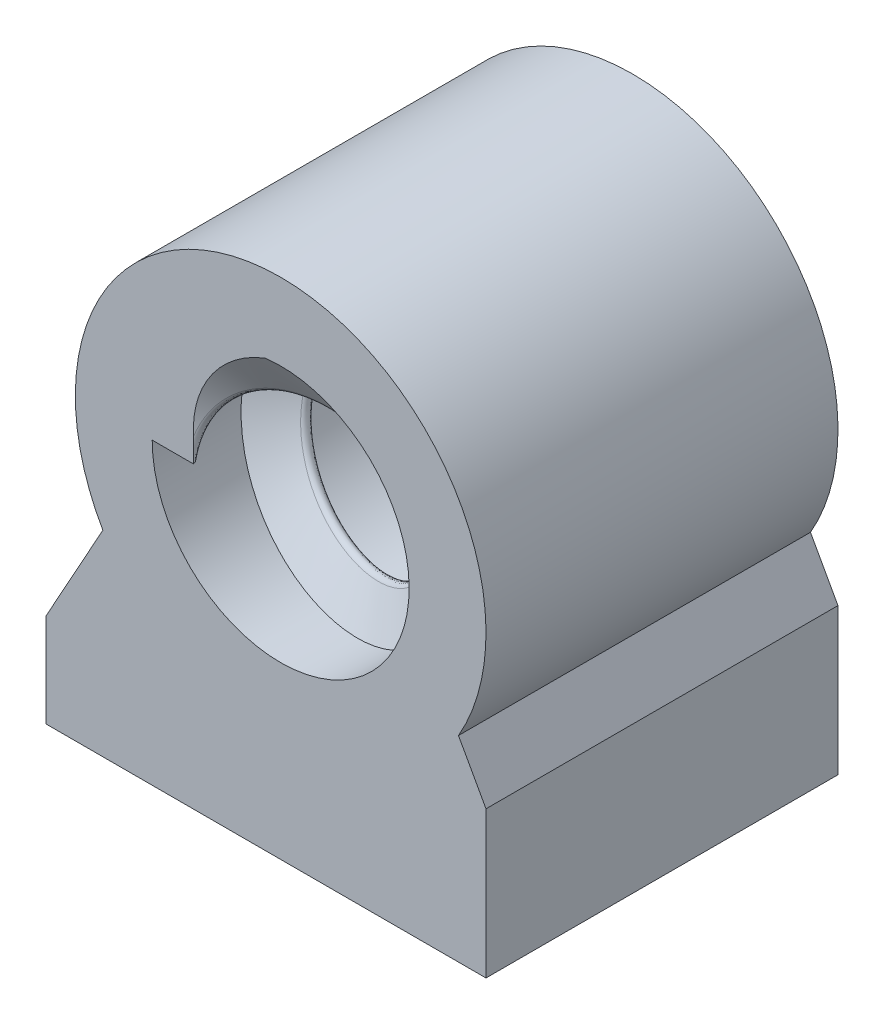
from build123d import *

# Parameters (mm, degrees)
SKETCH1_R               = 17.5
BOSS_EXTRUDE1_DEPTH     = 30
SKETCH5_R               = 10.95
CUT_EXTRUDE2_DEPTH      = 39.890873
SWEEP2_PITCH            = 10
SKETCH8_R               = 17.5
CUT_EXTRUDE3_DEPTH      = 41.699
SKETCH9_R               = 17.5
CUT_EXTRUDE4_DEPTH      = 39.890874
SKETCH10_W              = 40
SKETCH10_H              = 19.977262
BOSS_EXTRUDE2_DEPTH     = 40
SKETCH11_W              = 40
SKETCH11_H              = 19.977262
BOSS_EXTRUDE3_DEPTH     = 10
BOSS_EXTRUDE4_DEPTH     = 30
SKETCH14_R              = 1.905
CUT_EXTRUDE5_DEPTH      = 71.869594
SKETCH15_R              = 3.9243
CUT_EXTRUDE7_DEPTH      = 59.798031
SKETCH16_W              = 50
SKETCH16_H              = 19.977262
BOSS_EXTRUDE5_DEPTH     = 22
CUT_EXTRUDE8_DEPTH      = 12
BOSS_EXTRUDE6_DEPTH     = 19.977262
BOSS_EXTRUDE7_DEPTH     = 22
FILLET1_R               = 2
SKETCH21_W              = 7
SKETCH21_H              = 16
BOSS_EXTRUDE8_DEPTH     = 2
CUT_EXTRUDE9_DEPTH      = 76.769387
CUT_EXTRUDE9_DEPTH_BACK = 76.769387
SKETCH22_W              = 37.5
SKETCH22_H              = 30
SKETCH23_W              = 37.5
SKETCH23_H              = 30
CUT_EXTRUDE10_DEPTH     = 12


with BuildPart() as part:
    # Sketch1 → Boss-Extrude1 (new body)
    with BuildSketch(Plane.XY):
        Circle(SKETCH1_R)
    extrude(amount=BOSS_EXTRUDE1_DEPTH)

    # Sketch5 → Cut-Extrude2 (cut, through all)
    with BuildSketch(Plane(origin=(0, 0, 0), x_dir=(-1, 0, 0), z_dir=(0, 0, -1))):
        Circle(SKETCH5_R)
    extrude(amount=-CUT_EXTRUDE2_DEPTH, mode=Mode.SUBTRACT)

    # Sweep2: arcs per turn and ends read off the stored shape
    # Sweep2: the profile of Sketch7 profile screwed along a right-hand helix through 3.75 turns, 16 arcs to a turn; built about Z, then put on its axis
    sweep2_z = Axis((0, 0, 0), (0, 0, 1))
    sweep2_corners = [(0, 7.7, 2.933013), (0, 10.9503, 4.809574), (0, 10.9503, 0.190426), (0, 7.7, 2.066987), (0, 7.45, 2.5)]
    with BuildLine(mode=Mode.PRIVATE) as sweep2_profile:
        Line(sweep2_corners[0], sweep2_corners[1])
        Line(sweep2_corners[1], sweep2_corners[2])
        Line(sweep2_corners[2], sweep2_corners[3])
        ThreePointArc((0, 7.7, 2.066987), (0, 7.516988, 2.25), (0, 7.45, 2.5))
        ThreePointArc((0, 7.45, 2.5), (0, 7.516988, 2.75), (0, 7.7, 2.933013))
    sweep2_cap = Face(sweep2_profile.wire())
    sweep2_arcs = [((0, 7.7, 2.066987), (0, 7.45, 2.211325), (0, 7.45, 2.5), (1, 0.8660254037844395, 1)), ((0, 7.45, 2.5), (0, 7.45, 2.788675), (0, 7.7, 2.933013), (1, 0.8660254037844395, 1))]  # start, shoulder, end, weights
    sweep2_turn_angles = [0, 11.25, 22.5, 33.75, 45, 56.25, 67.5, 78.75, 90, 101.25, 112.5, 123.75, 135, 146.25, 157.5, 168.75, 180, 191.25, 202.5, 213.75, 225, 236.25, 247.5, 258.75, 270, 281.25, 292.5, 303.75, 315, 326.25, 337.5, 348.75, 360]
    sweep2_turn_weights = [1, 0.9807852804032304, 1, 0.9807852804032304, 1, 0.9807852804032304, 1, 0.9807852804032304, 1, 0.9807852804032304, 1, 0.9807852804032304, 1, 0.9807852804032304, 1, 0.9807852804032304, 1, 0.9807852804032304, 1, 0.9807852804032304, 1, 0.9807852804032304, 1, 0.9807852804032304, 1, 0.9807852804032304, 1, 0.9807852804032304, 1, 0.9807852804032304, 1, 0.9807852804032304, 1]
    sweep2_turn_rails = [Edge.make_bspline([Vector(p[0], p[1], 0).rotate(sweep2_z, sweep2_turn_angles[k]) / sweep2_turn_weights[k] + Vector(0, 0, p[2] + SWEEP2_PITCH * sweep2_turn_angles[k] / 360) for k in range(33)], [0, 0, 0, 1, 1, 2, 2, 3, 3, 4, 4, 5, 5, 6, 6, 7, 7, 8, 8, 9, 9, 10, 10, 11, 11, 12, 12, 13, 13, 14, 14, 15, 15, 16, 16, 16], 2, sweep2_turn_weights) for p in sweep2_corners]
    sweep2_turn_sides = [*[Face.make_surface_from_curves(sweep2_turn_rails[p[0]], sweep2_turn_rails[p[1]]) for p in [(0, 1), (1, 2), (2, 3)]], *[Face.make_bezier_surface([[Vector(p[j][0], p[j][1], 0).rotate(sweep2_z, sweep2_turn_angles[2 * i + k]) / sweep2_turn_weights[2 * i + k] + Vector(0, 0, p[j][2] + SWEEP2_PITCH * sweep2_turn_angles[2 * i + k] / 360) for k in range(3)] for j in range(3)], [[p[3][j] * sweep2_turn_weights[2 * i + k] for k in range(3)] for j in range(3)]) for p in sweep2_arcs for i in range(16)]]
    sweep2_last_angles = [1080, 1091.25, 1102.5, 1113.75, 1125, 1136.25, 1147.5, 1158.75, 1170, 1181.25, 1192.5, 1203.75, 1215, 1226.25, 1237.5, 1248.75, 1260, 1271.25, 1282.5, 1293.75, 1305, 1316.25, 1327.5, 1338.75, 1350]
    sweep2_last_weights = [1, 0.9807852804032304, 1, 0.9807852804032304, 1, 0.9807852804032304, 1, 0.9807852804032304, 1, 0.9807852804032304, 1, 0.9807852804032304, 1, 0.9807852804032304, 1, 0.9807852804032304, 1, 0.9807852804032304, 1, 0.9807852804032304, 1, 0.9807852804032304, 1, 0.9807852804032304, 1]
    sweep2_last_rails = [Edge.make_bspline([Vector(p[0], p[1], 0).rotate(sweep2_z, sweep2_last_angles[k]) / sweep2_last_weights[k] + Vector(0, 0, p[2] + SWEEP2_PITCH * sweep2_last_angles[k] / 360) for k in range(25)], [0, 0, 0, 1, 1, 2, 2, 3, 3, 4, 4, 5, 5, 6, 6, 7, 7, 8, 8, 9, 9, 10, 10, 11, 11, 12, 12, 12], 2, sweep2_last_weights) for p in sweep2_corners]
    sweep2_last_sides = [*[Face.make_surface_from_curves(sweep2_last_rails[p[0]], sweep2_last_rails[p[1]]) for p in [(0, 1), (1, 2), (2, 3)]], *[Face.make_bezier_surface([[Vector(p[j][0], p[j][1], 0).rotate(sweep2_z, sweep2_last_angles[2 * i + k]) / sweep2_last_weights[2 * i + k] + Vector(0, 0, p[j][2] + SWEEP2_PITCH * sweep2_last_angles[2 * i + k] / 360) for k in range(3)] for j in range(3)], [[p[3][j] * sweep2_last_weights[2 * i + k] for k in range(3)] for j in range(3)]) for p in sweep2_arcs for i in range(12)]]
    sweep2 = Plane(origin=(0, 0, -10), x_dir=(-1, 0, 0), z_dir=(0, 0, 1)) * Solid(Shell([*[p.moved(Location((0, 0, SWEEP2_PITCH * i))) for i in range(3) for p in sweep2_turn_sides], *sweep2_last_sides, sweep2_cap, sweep2_cap.rotate(sweep2_z, 1350).moved(Location((0, 0, SWEEP2_PITCH * 1350 / 360)))]))
    add(sweep2)

    # Sketch8 → Cut-Extrude3 (cut, through all)
    with BuildSketch(Plane(origin=(0, 0, 0), x_dir=(-1, 0, 0), z_dir=(0, 0, -1))):
        with Locations(Location((0, 0, 0), (0, 0, 180))):
            Circle(SKETCH8_R)
    extrude(amount=CUT_EXTRUDE3_DEPTH, mode=Mode.SUBTRACT)

    # Sketch9 → Cut-Extrude4 (cut, through all)
    with BuildSketch(Plane.XY.offset(30)):
        Circle(SKETCH9_R)
    extrude(amount=CUT_EXTRUDE4_DEPTH, mode=Mode.SUBTRACT)



with BuildPart() as body_2:
    # Sketch10 → Boss-Extrude2 (new body)
    with BuildSketch(Plane(origin=(0, 0, 0), x_dir=(-1, 0, 0), z_dir=(0, 0, -1))):
        with Locations((0, -27.488631)):
            Rectangle(SKETCH10_W, SKETCH10_H)
    extrude(amount=-BOSS_EXTRUDE2_DEPTH)

    # Sketch11 → Boss-Extrude3 (add)
    with BuildSketch(Plane(origin=(0, 0, 0), x_dir=(-1, 0, 0), z_dir=(0, 0, -1))):
        with Locations((0, -27.488631)):
            Rectangle(SKETCH11_W, SKETCH11_H)
    extrude(amount=BOSS_EXTRUDE3_DEPTH)


with BuildPart() as part_1:
    add(part.part)

    add(body_2.part)  # Boss-Extrude4 merges body 2
    # Sketch13 → Boss-Extrude4 (add)
    with BuildSketch(Plane(origin=(0, 0, 0), x_dir=(-1, 0, 0), z_dir=(0, 0, -1))):
        with BuildLine():
            Line((0, -17.5), (-20, -17.5))
            Line((-20, -17.5), (-15.153881, -8.752707))
            ThreePointArc((-15.153881, -8.752707), (-8.748646, -15.156226), (0, -17.5))
        make_face()
    boss_extrude4 = extrude(amount=-BOSS_EXTRUDE4_DEPTH)

    # Mirror1: Boss-Extrude4 across plane
    add(boss_extrude4.mirror(Plane(origin=(0, 0, 0), x_dir=(0, 0, 1), z_dir=(1, 0, 0))))

    # Sketch14 → Cut-Extrude5 (cut, through all)
    with BuildSketch(Plane.XZ.offset(37.477262)):
        with Locations(Location((-10, 34.242642, 0), (0, 0, 270))):
            Circle(SKETCH14_R)
        with Locations(Location((10, 34.242642, 0), (0, 0, 270))):
            Circle(SKETCH14_R)
        with Locations(Location((-10, -4.242642, 0), (0, 0, 270))):
            Circle(SKETCH14_R)
        with Locations(Location((10, -4.242642, 0), (0, 0, 270))):
            Circle(SKETCH14_R)
    extrude(amount=-CUT_EXTRUDE5_DEPTH, mode=Mode.SUBTRACT)

    # Sketch15 → Cut-Extrude7 (cut, through all)
    with BuildSketch(Plane(origin=(0, -20.6734, 0), x_dir=(1, 0, 0), z_dir=(0, 1, 0))):
        with Locations(Location((-10, 4.242642, 0), (0, 0, 270))):
            Circle(SKETCH15_R)
        with Locations(Location((10, 4.242642, 0), (0, 0, 270))):
            Circle(SKETCH15_R)
        with Locations(Location((10, -34.242642, 0), (0, 0, 270))):
            Circle(SKETCH15_R)
        with Locations(Location((-10, -34.242642, 0), (0, 0, 270))):
            Circle(SKETCH15_R)
    extrude(amount=CUT_EXTRUDE7_DEPTH, mode=Mode.SUBTRACT)

    # Sketch16 → Boss-Extrude5 (add)
    with BuildSketch(Plane.ZY.offset(20)):
        with Locations((15, -27.488631)):
            Rectangle(SKETCH16_W, SKETCH16_H)
    extrude(amount=BOSS_EXTRUDE5_DEPTH)

    # Sketch17 → Cut-Extrude8 (cut)
    with BuildSketch(Plane.ZY.offset(37)):
        Polygon((4, -24.5), (8.5, -24.5), (8.5, -29.488888), (11, -29.488888), (11, -24.5), (26, -24.5), (26, -17.5), (4, -17.5), align=None)
    extrude(amount=-CUT_EXTRUDE8_DEPTH, mode=Mode.SUBTRACT)

    # Sketch19 → Boss-Extrude6 (add, through all)
    with BuildSketch(Plane(origin=(0, -17.5, 0), x_dir=(1, 0, 0), z_dir=(0, 1, 0))):
        Polygon((-42, -12), (-49, -12), (-49, -7), (-54, -7), (-54, -23), (-49, -23), (-49, -18), (-42, -18), align=None)
    extrude(amount=-BOSS_EXTRUDE6_DEPTH)

    # Sketch20 → Boss-Extrude7 (add)
    with BuildSketch(Plane(origin=(0, -17.5, 0), x_dir=(1, 0, 0), z_dir=(0, 1, 0))):
        Polygon((-54, -7), (-49, -7), (-49, -12), (-42, -12), (-42, -7), (-37, -7), (-37, -23), (-42, -23), (-42, -18), (-49, -18), (-49, -23), (-54, -23), align=None)
    extrude(amount=BOSS_EXTRUDE7_DEPTH)

    # Fillet1
    fillet1_edges = [part_1.edges().sort_by_distance(p)[0] for p in [
        (-42, -16.488631, 12),
        (-42, -16.488631, 18),
        (-49, -16.488631, 18),
        (-49, -16.488631, 12),
    ]]
    fillet(fillet1_edges, radius=FILLET1_R)

    # Sketch21 → Boss-Extrude8 (add)
    with BuildSketch(Plane.XZ.offset(37.477262)):
        with Locations((-45.5, 15)):
            Rectangle(SKETCH21_W, SKETCH21_H)
    extrude(amount=-BOSS_EXTRUDE8_DEPTH)

    # Sketch22 → Cut-Extrude9 (cut, two sides: drawn at the far end of the back side and taken through both)
    with BuildSketch(Plane(origin=(0, -17.5, 0), x_dir=(1, 0, 0), z_dir=(0, 1, 0)).offset(-CUT_EXTRUDE9_DEPTH_BACK)):
        Polygon((-42, 10), (20, 10), (20, -40), (-42, -40), (-42, -43.533201), (-59.604313, -43.533201), (-59.604313, 10), align=None)
        with Locations((-1.25, -15)):
            Rectangle(SKETCH22_W, SKETCH22_H, mode=Mode.SUBTRACT)
    extrude(amount=CUT_EXTRUDE9_DEPTH + CUT_EXTRUDE9_DEPTH_BACK, mode=Mode.SUBTRACT)

    # Sketch23 → Cut-Extrude10 (cut)
    with BuildSketch(Plane.XZ.offset(37.477262)):
        with Locations((-1.25, 15)):
            Rectangle(SKETCH23_W, SKETCH23_H)
    extrude(amount=-CUT_EXTRUDE10_DEPTH, mode=Mode.SUBTRACT)


solid = part_1.part
